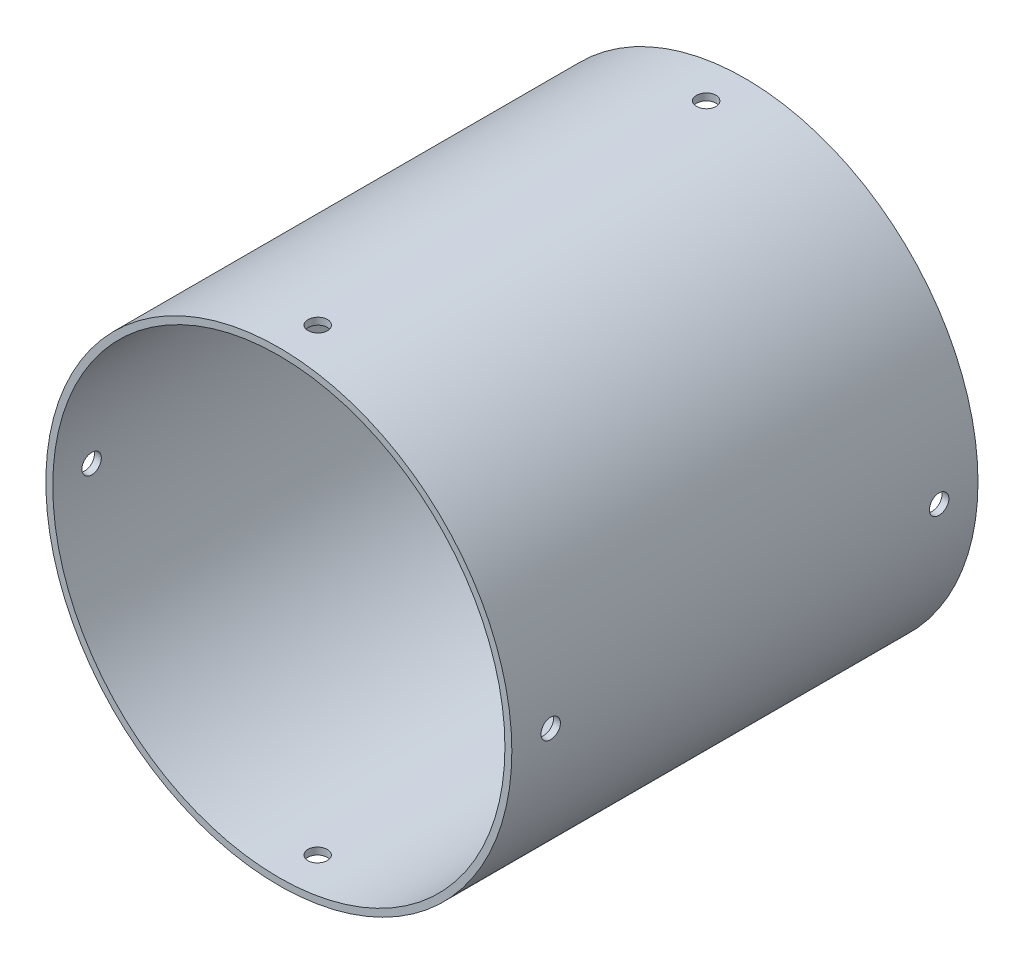
from build123d import *

# Parameters (mm, degrees)
SKETCH1_R           = 76.1746
SKETCH1_R_2         = 73.914
BOSS_EXTRUDE1_DEPTH = 152.4
SKETCH2_R           = 3.175
CUT_EXTRUDE1_DEPTH  = 25.4
CIRPATTERN1_COUNT   = 4


with BuildPart() as part:
    # Sketch1 → Boss-Extrude1 (new body)
    with BuildSketch(Plane.XY):
        Circle(SKETCH1_R)
        Circle(SKETCH1_R_2, mode=Mode.SUBTRACT)
    extrude(amount=BOSS_EXTRUDE1_DEPTH)

    # Sketch2 → Cut-Extrude1 (cut)
    with BuildSketch(Plane(origin=(76.2, 0, 0), x_dir=(0, 0, -1), z_dir=(1, 0, 0))):
        with Locations((-139.7, 0)):
            Circle(SKETCH2_R)
        with Locations((-12.7, 0)):
            Circle(SKETCH2_R)
    cut_extrude1 = extrude(amount=-CUT_EXTRUDE1_DEPTH, mode=Mode.SUBTRACT)

    # CirPattern1: Cut-Extrude1 ×4 about axis
    cirpattern1_axis = Axis((0, 0, 152.4), (0, 0, -1))
    for i in range(1, CIRPATTERN1_COUNT):
        add(cut_extrude1.rotate(cirpattern1_axis, i * 360 / CIRPATTERN1_COUNT), mode=Mode.SUBTRACT)


solid = part.part
